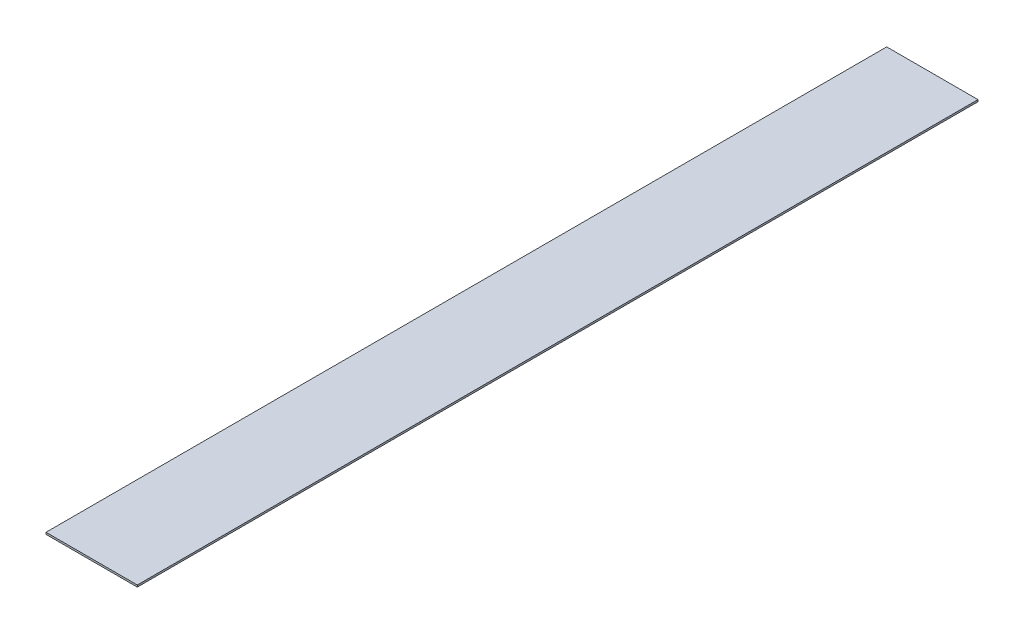
from build123d import *

# Parameters (mm, degrees)
SKETCH2_W           = 4.92
SKETCH2_H           = 45.3
BOSS_EXTRUDE1_DEPTH = 0.05


with BuildPart() as part:
    # Sketch2 → Boss-Extrude1 (new, symmetric)
    with BuildSketch(Plane(origin=(0, 0, 0), x_dir=(1, 0, 0), z_dir=(0, 1, 0))):
        Rectangle(SKETCH2_W, SKETCH2_H)
    extrude(amount=BOSS_EXTRUDE1_DEPTH, both=True)


solid = part.part
